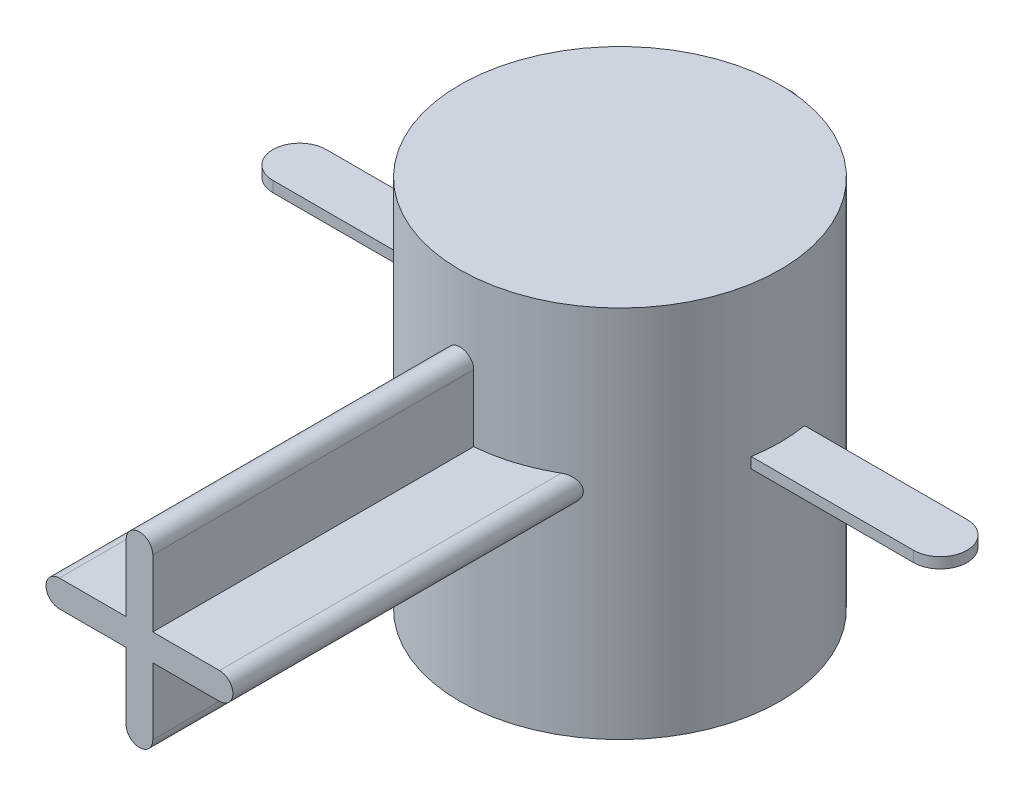
from build123d import *
from build123d.topology import SkipClean

# Parameters (mm, degrees)
SKETCH1_R                       = 38.1
BOSS_EXTRUDE1_DEPTH             = 88.9
BOSS_EXTRUDE2_DEPTH             = 2.54
BOSS_EXTRUDE4_REACH             = 145.263
BOSS_EXTRUDE4_END_RADIUS        = 38.1
BOSS_EXTRUDE4_DIRECTION_2_DEPTH = 76.2
BOSS_EXTRUDE7_REACH             = 196.791
BOSS_EXTRUDE7_END_RADIUS        = 38.1
SKETCH7_R                       = 5.08
SKETCH7_R_2                     = 3.175
BOSS_EXTRUDE7_DIRECTION_2_DEPTH = 2.54


with BuildPart() as part:
    # Sketch1 → Boss-Extrude1 (new body)
    with BuildSketch(Plane(origin=(0, 0, 0), x_dir=(1, 0, 0), z_dir=(0, 1, 0))):
        Circle(SKETCH1_R)
    extrude(amount=BOSS_EXTRUDE1_DEPTH)

    # Sketch3 → Boss-Extrude2 (add)
    with BuildSketch(Plane(origin=(0, 50.8, 0), x_dir=(1, 0, 0), z_dir=(0, 1, 0))):
        with BuildLine():
            Line((-76.2, 6.35), (76.2, 6.35))
            ThreePointArc((76.2, 6.35), (82.55, 0), (76.2, -6.35))
            Line((76.2, -6.35), (-76.2, -6.35))
            ThreePointArc((-76.2, -6.35), (-82.55, 0), (-76.2, 6.35))
        make_face()
    extrude(amount=BOSS_EXTRUDE2_DEPTH)

    # Boss-Extrude7: up to this cylinder (the profile starts outside it)
    boss_extrude7_end = Plane(origin=(0, 81.28, 0), z_dir=(0, -1, 0)) * Cylinder(BOSS_EXTRUDE7_END_RADIUS, 470.782, mode=Mode.PRIVATE)
    # Sketch7 → Boss-Extrude7 (add, up to the surface)
    with BuildSketch(Plane(origin=(0, 88.9, -38.1), x_dir=(-1, 0, 0), z_dir=(0, 0, -1)), mode=Mode.PRIVATE) as boss_extrude7_sk1:
        with Locations((0, -7.62)):
            Circle(SKETCH7_R)
        with Locations((0, -7.62)):
            Circle(SKETCH7_R_2, mode=Mode.SUBTRACT)
    boss_extrude7_tool1 = extrude(boss_extrude7_sk1.sketch, amount=-BOSS_EXTRUDE7_REACH, mode=Mode.PRIVATE) - boss_extrude7_end
    add(boss_extrude7_tool1.solids().sort_by_distance((4.936316, 81.28, -38.1))[0])
    add(boss_extrude7_tool1.solids().sort_by_distance((4.936316, 81.28, -38.1))[1])

    # Sketch7 → Boss-Extrude7 direction 2 (add)
    with SkipClean():  # the faces are left unmerged after this step: merging them gives an invalid solid
        with BuildSketch(Plane(origin=(0, 88.9, -38.1), x_dir=(-1, 0, 0), z_dir=(0, 0, -1))):
            with Locations((0, -7.62)):
                Circle(SKETCH7_R)
            with Locations((0, -7.62)):
                Circle(SKETCH7_R_2, mode=Mode.SUBTRACT)
        extrude(amount=BOSS_EXTRUDE7_DIRECTION_2_DEPTH)


with BuildPart() as body_2:
    # Boss-Extrude4: up to this cylinder (the profile starts outside it)
    boss_extrude4_end = Plane(origin=(0, 50.8, 0), z_dir=(0, -1, 0)) * Cylinder(BOSS_EXTRUDE4_END_RADIUS, 367.726, mode=Mode.PRIVATE)
    # Sketch5 → Boss-Extrude4 (new, up to the surface)
    with BuildSketch(Plane.XY.offset(38.1), mode=Mode.PRIVATE) as boss_extrude4_sk1:
        with BuildLine():
            Line((-19.05, 53.975), (-3.175, 53.975))
            Line((-3.175, 53.975), (-3.175, 69.85))
            ThreePointArc((-3.175, 69.85), (0, 73.025), (3.175, 69.85))
            Line((3.175, 69.85), (3.175, 53.975))
            Line((3.175, 53.975), (19.05, 53.975))
            ThreePointArc((19.05, 53.975), (22.225, 50.8), (19.05, 47.625))
            Line((19.05, 47.625), (3.175, 47.625))
            Line((3.175, 47.625), (3.175, 31.75))
            ThreePointArc((3.175, 31.75), (0, 28.575), (-3.175, 31.75))
            Line((-3.175, 31.75), (-3.175, 47.625))
            Line((-3.175, 47.625), (-19.05, 47.625))
            ThreePointArc((-19.05, 47.625), (-22.225, 50.8), (-19.05, 53.975))
        make_face()
    boss_extrude4_tool1 = extrude(boss_extrude4_sk1.sketch, amount=-BOSS_EXTRUDE4_REACH, mode=Mode.PRIVATE) - boss_extrude4_end
    add(boss_extrude4_tool1.solids().sort_by_distance((0, 50.8, 38.1))[0])
    add(boss_extrude4_tool1.solids().sort_by_distance((0, 50.8, 38.1))[1])

    # Sketch5 → Boss-Extrude4 direction 2 (add)
    with BuildSketch(Plane.XY.offset(38.1)):
        with BuildLine():
            Line((-19.05, 53.975), (-3.175, 53.975))
            Line((-3.175, 53.975), (-3.175, 69.85))
            ThreePointArc((-3.175, 69.85), (0, 73.025), (3.175, 69.85))
            Line((3.175, 69.85), (3.175, 53.975))
            Line((3.175, 53.975), (19.05, 53.975))
            ThreePointArc((19.05, 53.975), (22.225, 50.8), (19.05, 47.625))
            Line((19.05, 47.625), (3.175, 47.625))
            Line((3.175, 47.625), (3.175, 31.75))
            ThreePointArc((3.175, 31.75), (0, 28.575), (-3.175, 31.75))
            Line((-3.175, 31.75), (-3.175, 47.625))
            Line((-3.175, 47.625), (-19.05, 47.625))
            ThreePointArc((-19.05, 47.625), (-22.225, 50.8), (-19.05, 53.975))
        make_face()
    extrude(amount=BOSS_EXTRUDE4_DIRECTION_2_DEPTH)


solid = Compound([part.part, body_2.part])
